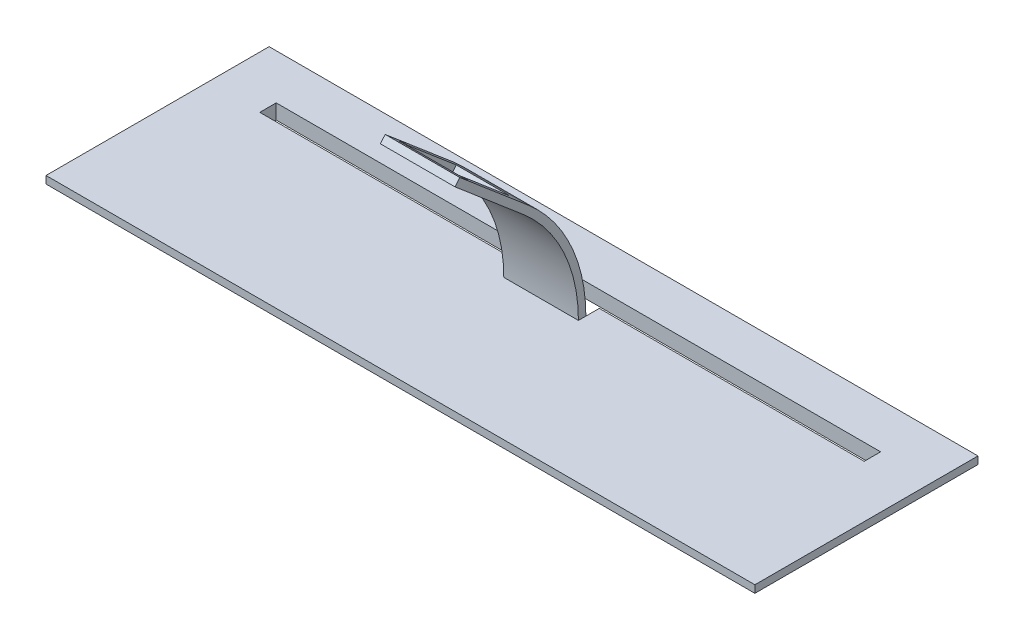
from build123d import *

# Parameters (mm, degrees)
SKETCH1_W                = 234.95
SKETCH1_H                = 69.596
BOSS_EXTRUDE1_DEPTH      = 2.54
SKETCH2_W                = 241.3
SKETCH2_H                = 75.946
BOSS_EXTRUDE2_DEPTH      = 2.54
CUT_EXTRUDE2_DEPTH       = 127.5866408
BOSS_EXTRUDE7_DEPTH      = 12.7
BOSS_EXTRUDE7_DEPTH_BACK = 12.7
SKETCH5_W                = 25.4
SKETCH5_H                = 2.54
BOSS_EXTRUDE8_DEPTH      = 30.48
CUT_EXTRUDE3_REACH       = 142.885
SKETCH6_W                = 18.288
SKETCH6_H                = 23.01875
CUT_EXTRUDE4_REACH       = 142.885
SKETCH9_R                = 1


with BuildPart() as part:
    # Sketch1 → Boss-Extrude1 (new body)
    with BuildSketch(Plane(origin=(0, 0, 0), x_dir=(1, 0, 0), z_dir=(0, 1, 0))):
        Rectangle(SKETCH1_W, SKETCH1_H)
    extrude(amount=BOSS_EXTRUDE1_DEPTH)

    # Sketch2 → Boss-Extrude2 (add)
    with BuildSketch(Plane(origin=(0, 2.54, 0), x_dir=(1, 0, 0), z_dir=(0, 1, 0))):
        Rectangle(SKETCH2_W, SKETCH2_H)
    extrude(amount=BOSS_EXTRUDE2_DEPTH)

    # Sketch3 → Cut-Extrude2 (cut, through all)
    with BuildSketch(Plane(origin=(0, 5.08, 0), x_dir=(1, 0, 0), z_dir=(0, 1, 0))):
        Polygon((102.87, 22.606), (-102.87, 22.606), (-102.87, 17.018), (-12.7, 17.018), (-12.7, 12.446), (12.7, 12.446), (12.7, 17.018), (102.87, 17.018), align=None)
    extrude(amount=-CUT_EXTRUDE2_DEPTH, mode=Mode.SUBTRACT)

    # Sketch4 → Boss-Extrude7 (add, two sides: drawn at the far end of the back side and taken through both)
    with BuildSketch(Plane(origin=(0, 0, 0), x_dir=(0, 0, -1), z_dir=(1, 0, 0)).offset(-BOSS_EXTRUDE7_DEPTH_BACK)):
        with BuildLine():
            Line((9.906, 5.08), (12.446, 5.08))
            ThreePointArc((12.446, 5.08), (7.285974935, 28.533326897), (-7.241134665, 47.655238095))
            Line((-7.241134665, 47.655238095), (-8.886264908, 45.72))
            ThreePointArc((-8.886264908, 45.72), (4.980521529, 27.467266584), (9.906, 5.08))
        make_face()
    extrude(amount=BOSS_EXTRUDE7_DEPTH + BOSS_EXTRUDE7_DEPTH_BACK)

    # Sketch5 → Boss-Extrude8 (add)
    with BuildSketch(Plane(origin=(0, 23.564762633, 27.720252887), x_dir=(1, 0, 0), z_dir=(0, 0.6476890718445453, 0.7619047619047618))):
        with Locations((0, 30.348749044)):
            Rectangle(SKETCH5_W, SKETCH5_H)
    extrude(amount=BOSS_EXTRUDE8_DEPTH)

    # Sketch6 → Cut-Extrude3 (cut, up to next)
    with BuildSketch(Plane(origin=(0, 24.090475462, -20.479118221), x_dir=(1, 0, 0), z_dir=(0, 0.7619047619047616, -0.6476890718445452)), mode=Mode.PRIVATE) as cut_extrude3_sk1:
        with Locations((0, -51.265157917)):
            Rectangle(SKETCH6_W, SKETCH6_H)
    cut_extrude3_tool1 = extrude(cut_extrude3_sk1.sketch, amount=-CUT_EXTRUDE3_REACH, mode=Mode.PRIVATE) & part.part
    add(cut_extrude3_tool1.solids().sort_by_distance((0, 57.294358, 18.58005))[0], mode=Mode.SUBTRACT)

    # Sketch9 → Cut-Extrude4 (cut, up to next)
    with BuildSketch(Plane(origin=(0, 24.090475462, -20.479118221), x_dir=(1, 0, 0), z_dir=(0, 0.7619047619047616, -0.6476890718445452)), mode=Mode.PRIVATE) as cut_extrude4_sk1:
        with Locations((-10.31875, -61.980782917)):
            Circle(SKETCH9_R)
    cut_extrude4_tool1 = extrude(cut_extrude4_sk1.sketch, amount=-CUT_EXTRUDE4_REACH, mode=Mode.PRIVATE) & part.part
    # Sketch9 → Cut-Extrude4 (cut, up to next)
    with BuildSketch(Plane(origin=(0, 24.090475462, -20.479118221), x_dir=(1, 0, 0), z_dir=(0, 0.7619047619047616, -0.6476890718445452)), mode=Mode.PRIVATE) as cut_extrude4_sk2:
        with Locations((10.31875, -61.980782917)):
            Circle(SKETCH9_R)
    cut_extrude4_tool2 = extrude(cut_extrude4_sk2.sketch, amount=-CUT_EXTRUDE4_REACH, mode=Mode.PRIVATE) & part.part
    add(cut_extrude4_tool1.solids().sort_by_distance((-10.31875, 64.234751, 26.744335))[0], mode=Mode.SUBTRACT)
    add(cut_extrude4_tool2.solids().sort_by_distance((10.31875, 64.234751, 26.744335))[0], mode=Mode.SUBTRACT)


solid = part.part
